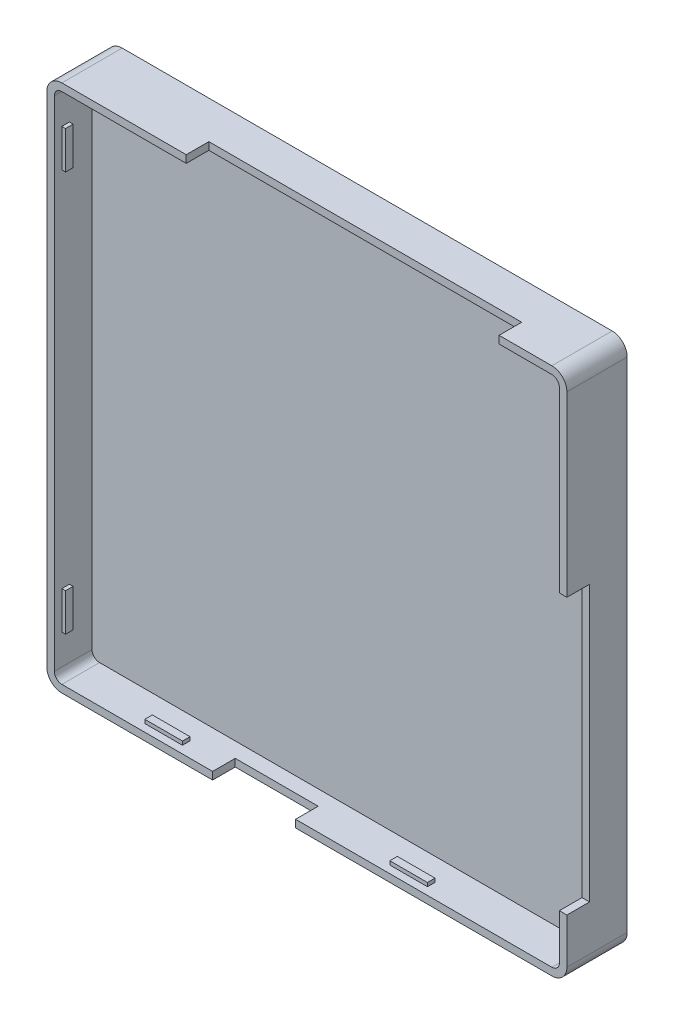
from build123d import *

# Parameters (mm, degrees)
BOSS_EXTRU_1_DEPTH      = 8
ENL_V_MAT_EXTRU_1_DEPTH = 5
ESQUISSE4_W             = 5
ESQUISSE4_H             = 1
BOSS_EXTRU_3_DEPTH      = 0.48904
ESQUISSE5_W             = 1
ESQUISSE5_H             = 5
BOSS_EXTRU_4_DEPTH      = 0.48904
ESQUISSE6_W             = 1
ESQUISSE6_H             = 5
BOSS_EXTRU_5_DEPTH      = 0.48904
ESQUISSE7_W             = 1
ESQUISSE7_H             = 5
BOSS_EXTRU_6_DEPTH      = 0.48904
ESQUISSE8_W             = 5
ESQUISSE8_H             = 1
BOSS_EXTRU_7_DEPTH      = 0.48904
ESQUISSE9_W             = 5
ESQUISSE9_H             = 1
BOSS_EXTRU_8_DEPTH      = 0.48904
ESQUISSE10_W            = 3
ESQUISSE10_H            = 36.5
ENL_V_MAT_EXTRU_3_DEPTH = 98.989846413
ESQUISSE11_W            = 41.5
ESQUISSE11_H            = 3
ENL_V_MAT_EXTRU_4_DEPTH = 98.978620117
ESQUISSE12_W            = 11
ESQUISSE12_H            = 3
ENL_V_MAT_EXTRU_5_DEPTH = 98.978620117


with BuildPart() as part:
    # Esquisse1 → Boss.-Extru.1 (new body)
    with BuildSketch(Plane.XY):
        with BuildLine():
            Line((2, 0), (67, 0))
            ThreePointArc((67, 0), (68.414213562, 0.585786438), (69, 2))
            Line((69, 2), (69, 68.1))
            ThreePointArc((69, 68.1), (68.414213562, 69.514213562), (67, 70.1))
            Line((67, 70.1), (2, 70.1))
            ThreePointArc((2, 70.1), (0.585786438, 69.514213562), (0, 68.1))
            Line((0, 68.1), (0, 2))
            ThreePointArc((0, 2), (0.585786438, 0.585786438), (2, 0))
        make_face()
    extrude(amount=BOSS_EXTRU_1_DEPTH)

    # Esquisse3 → Enlèv. mat.-Extru.1 (cut)
    with BuildSketch(Plane.XY.offset(8)):
        with BuildLine():
            Line((2, 1), (67, 1))
            ThreePointArc((67, 1), (67.707106781, 1.292893219), (68, 2))
            Line((68, 2), (68, 68.1))
            ThreePointArc((68, 68.1), (67.707106781, 68.807106781), (67, 69.1))
            Line((67, 69.1), (2, 69.1))
            ThreePointArc((2, 69.1), (1.292893219, 68.807106781), (1, 68.1))
            Line((1, 68.1), (1, 2))
            ThreePointArc((1, 2), (1.292893219, 1.292893219), (2, 1))
        make_face()
    extrude(amount=-ENL_V_MAT_EXTRU_1_DEPTH, mode=Mode.SUBTRACT)

    # Esquisse4 → Boss.-Extru.3 (add)
    with BuildSketch(Plane.XZ.offset(-69.1)):
        with Locations((10.679731729, 6.5)):
            Rectangle(ESQUISSE4_W, ESQUISSE4_H)
    extrude(amount=BOSS_EXTRU_3_DEPTH)

    # Esquisse5 → Boss.-Extru.4 (add)
    with BuildSketch(Plane.ZY.offset(-68)):
        with Locations((6.5, 62.6)):
            Rectangle(ESQUISSE5_W, ESQUISSE5_H)
    extrude(amount=BOSS_EXTRU_4_DEPTH)

    # Esquisse6 → Boss.-Extru.5 (add)
    with BuildSketch(Plane(origin=(1, 0, 0), x_dir=(0, 0, -1), z_dir=(1, 0, 0))):
        with Locations((-6.5, 61.6)):
            Rectangle(ESQUISSE6_W, ESQUISSE6_H)
    extrude(amount=BOSS_EXTRU_5_DEPTH)

    # Esquisse7 → Boss.-Extru.6 (add)
    with BuildSketch(Plane(origin=(1, 0, 0), x_dir=(0, 0, -1), z_dir=(1, 0, 0))):
        with Locations((-6.5, 8.5)):
            Rectangle(ESQUISSE7_W, ESQUISSE7_H)
    extrude(amount=BOSS_EXTRU_6_DEPTH)

    # Esquisse8 → Boss.-Extru.7 (add)
    with BuildSketch(Plane(origin=(0, 1, 0), x_dir=(1, 0, 0), z_dir=(0, 1, 0))):
        with Locations((14.5, -6.5)):
            Rectangle(ESQUISSE8_W, ESQUISSE8_H)
    extrude(amount=BOSS_EXTRU_7_DEPTH)

    # Esquisse9 → Boss.-Extru.8 (add)
    with BuildSketch(Plane(origin=(0, 1, 0), x_dir=(1, 0, 0), z_dir=(0, 1, 0))):
        with Locations((47, -6.5)):
            Rectangle(ESQUISSE9_W, ESQUISSE9_H)
    extrude(amount=BOSS_EXTRU_8_DEPTH)

    # Esquisse10 → Enlèv. mat.-Extru.3 (cut, through all)
    with BuildSketch(Plane.ZY.offset(-68)):
        with Locations((6.5, 26.25)):
            Rectangle(ESQUISSE10_W, ESQUISSE10_H)
    extrude(amount=-ENL_V_MAT_EXTRU_3_DEPTH, mode=Mode.SUBTRACT)

    # Esquisse11 → Enlèv. mat.-Extru.4 (cut, through all)
    with BuildSketch(Plane.XZ.offset(-69.1)):
        with Locations((39.25, 6.5)):
            Rectangle(ESQUISSE11_W, ESQUISSE11_H)
    extrude(amount=-ENL_V_MAT_EXTRU_4_DEPTH, mode=Mode.SUBTRACT)

    # Esquisse12 → Enlèv. mat.-Extru.5 (cut, through all)
    with BuildSketch(Plane(origin=(0, 1, 0), x_dir=(1, 0, 0), z_dir=(0, 1, 0))):
        with Locations((27.5, -6.5)):
            Rectangle(ESQUISSE12_W, ESQUISSE12_H)
    extrude(amount=-ENL_V_MAT_EXTRU_5_DEPTH, mode=Mode.SUBTRACT)


solid = part.part
